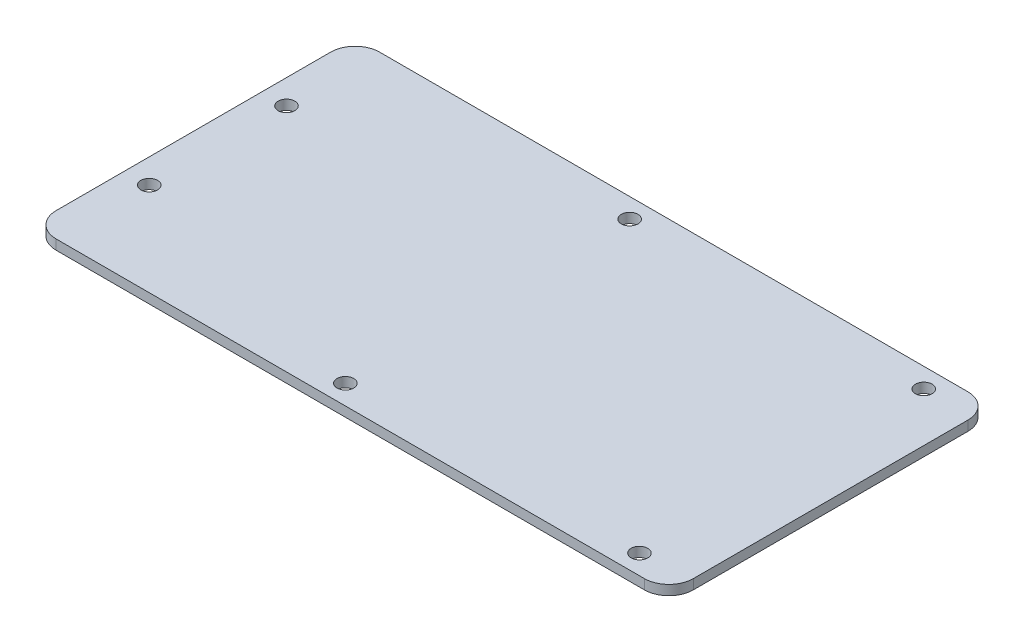
from build123d import *

# Parameters (mm, degrees)
SKETCH1_W            = 130
SKETCH1_H            = 66
BOSS_EXTRUDE1_DEPTH  = 2
FILLET1_R            = 5
M3_CLEARANCE_HOLE1_D = 3.4


with BuildPart() as part:
    # Sketch1 → Boss-Extrude1 (new body)
    with BuildSketch(Plane(origin=(0, 0, 0), x_dir=(1, 0, 0), z_dir=(0, 1, 0))):
        with Locations((65, 33)):
            Rectangle(SKETCH1_W, SKETCH1_H)
    extrude(amount=BOSS_EXTRUDE1_DEPTH)

    # Fillet1
    fillet1_edges = [part.edges().sort_by_distance(p)[0] for p in [
        (130, 1, -66),
        (130, 1, 0),
        (0, 1, 0),
        (0, 1, -66),
    ]]
    fillet(fillet1_edges, radius=FILLET1_R)

    # M3 Clearance Hole1 (through all)
    with Locations(Plane(origin=(0, 2, 0), x_dir=(1, 0, 0), z_dir=(0, 1, 0))):
        with Locations((5, 19), (60, 4), (120, 4), (120, 62), (60, 62), (5, 47)):
            Hole(M3_CLEARANCE_HOLE1_D / 2)


solid = part.part
